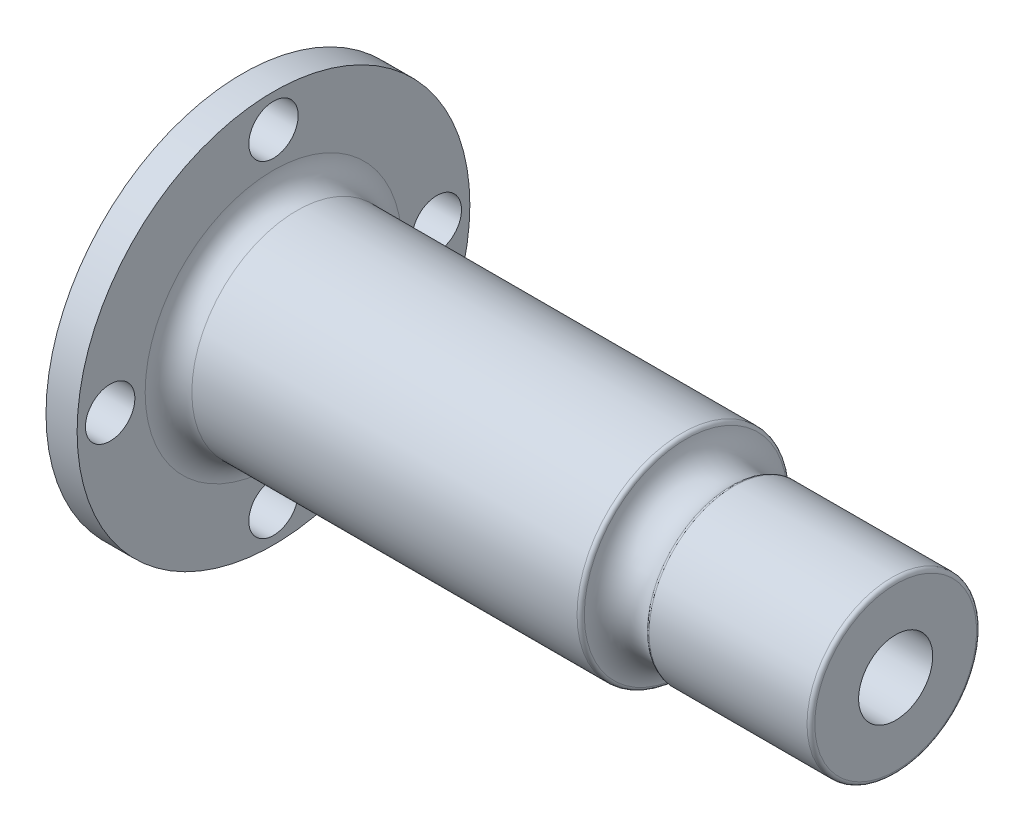
from build123d import *

# Parameters (mm, degrees)
FILLET1_R          = 0.5
FILLET2_R          = 3
SKETCH3_R          = 4.7625
CUT_EXTRUDE1_DEPTH = 99.234887094
SKETCH4_R          = 3.175
CUT_EXTRUDE3_DEPTH = 140.256184782


with BuildPart() as part:
    # Sketch1 → Revolve1 (revolve)
    with BuildSketch(Plane.XY):
        with BuildLine():
            Line((134.6, 0), (134.6, 10.9))
            Line((134.6, 10.9), (113.6, 10.9))
            ThreePointArc((113.6, 10.9), (109.746525497, 10.230443455), (107.6, 13.5))
            Line((107.6, 13.5), (54.6, 13.5))
            Line((54.6, 13.5), (54.6, 27.5))
            Line((54.6, 27.5), (47.6, 27.5))
            Line((47.6, 27.5), (47.6, 32.25))
            Line((47.6, 32.25), (44.6, 32.25))
            Line((44.6, 32.25), (44.6, 37))
            Line((44.6, 37), (40.6, 37))
            Line((40.6, 37), (40.6, 42))
            Line((40.6, 42), (23, 42))
            Line((23, 42), (23, 43))
            Line((23, 43), (5, 43))
            Line((5, 43), (5, 44))
            Line((5, 44), (0, 44))
            Line((0, 44), (0, 0))
            Line((0, 0), (134.6, 0))
        make_face()
    revolve(axis=Axis((-159.727345132, 0, 0), (1, 0, 0)))

    # Fillet1
    fillet1_edges = [part.edges().sort_by_distance(p)[0] for p in [
        (134.6, -10.9, 0),
        (113.6, -10.9, 0),
        (107.6, -13.5, 0),
        (54.6, -27.5, 0),
        (47.6, -27.5, 0),
        (47.6, -32.25, 0),
        (44.6, -32.25, 0),
        (44.6, -37, 0),
        (40.6, -37, 0),
        (40.6, -42, 0),
        (23, -42, 0),
        (5, -43, 0),
    ]]
    fillet(fillet1_edges, radius=FILLET1_R)

    # Fillet2
    fillet2_edges = [part.edges().sort_by_distance(p)[0] for p in [
        (54.6, -13.5, 0),
    ]]
    fillet(fillet2_edges, radius=FILLET2_R)

    # Sketch2 → Cut-Revolve1 (revolve, cut)
    with BuildSketch(Plane.XY):
        Polygon((50.6, 25.25), (64.002595821, 25.25), (64.002595821, 54.446385227), (-9.354779202, 54.446385227), (-9.354779202, 0), (39.6, 0), (43.085148515, 0), (43.085148515, 8), align=None)
    revolve(axis=Axis((-12.93677823, 0, 0), (1, 0, 0)), mode=Mode.SUBTRACT)

    # Sketch3 → Cut-Extrude1 (cut, through all)
    with BuildSketch(Plane(origin=(134.6, 0, 0), x_dir=(0, 0, -1), z_dir=(1, 0, 0))):
        Circle(SKETCH3_R)
    extrude(amount=-CUT_EXTRUDE1_DEPTH, mode=Mode.SUBTRACT)

    # Sketch4 → Cut-Extrude3 (cut, through all)
    with BuildSketch(Plane(origin=(0, 0, 0), x_dir=(0, 0, -1), z_dir=(1, 0, 0))):
        with Locations((21, 0)):
            Circle(SKETCH4_R)
        with Locations((0, -21)):
            Circle(SKETCH4_R)
        with Locations((0, 21)):
            Circle(SKETCH4_R)
        with Locations((-21, 0)):
            Circle(SKETCH4_R)
    extrude(amount=CUT_EXTRUDE3_DEPTH, mode=Mode.SUBTRACT)


solid = part.part
